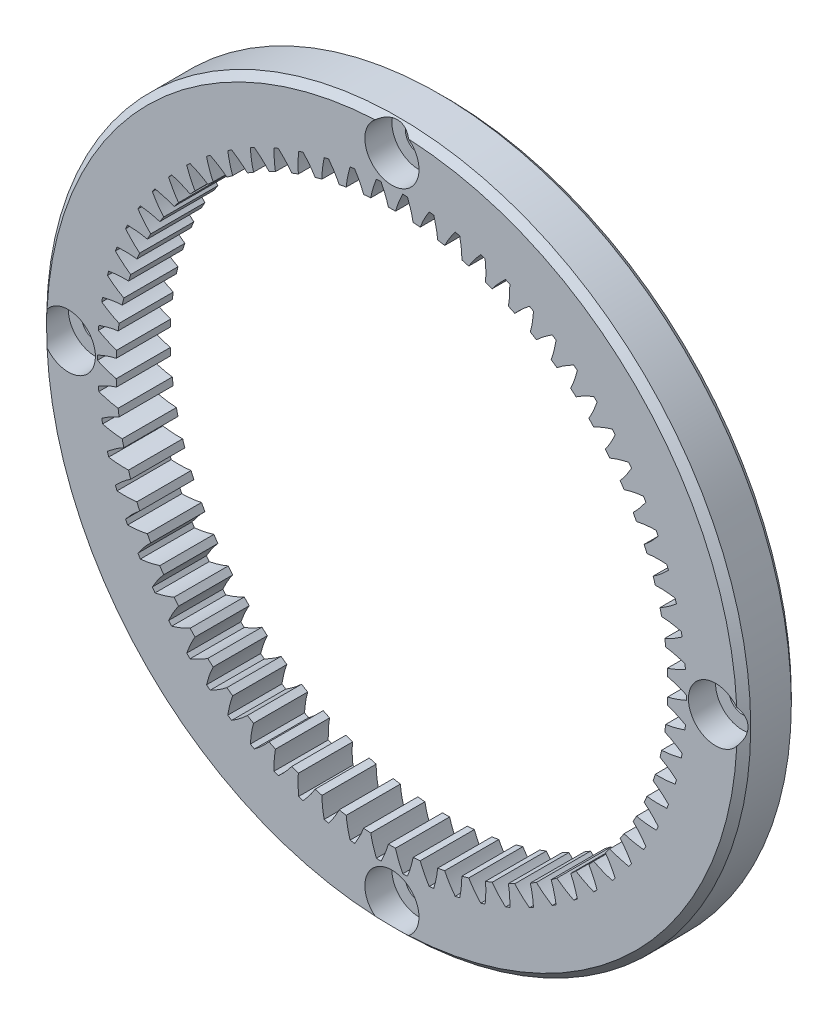
from build123d import *

# Parameters (mm, degrees)
EXTRUDE_1_OUTLINE_R      = 26
EXTRUDE_1_OUTLINE_R_2    = 21.75
EXTRUDE_1_DEPTH          = 4
EXTRUDE_2_DEPTH          = 4
PATTERN_CIRCULAR_1_COUNT = 70
CHAMFER_1_SIZE           = 0.5
SKETCH_8_R               = 1
CUT_EXTRUDE_5_DEPTH      = 37.986484029
SKETCH_9_R               = 2
CUT_EXTRUDE_7_DEPTH      = 2
PATTERN_CIRCULAR_4_COUNT = 4


# Read off the part's stored shape, not the designer's step: 凸台-拉伸1
with BuildPart() as part:
    # 凸台-拉伸1 outline → 凸台-拉伸1 (new body)
    with BuildSketch(Plane.XY):
        Circle(EXTRUDE_1_OUTLINE_R)
        Circle(EXTRUDE_1_OUTLINE_R_2, mode=Mode.SUBTRACT)
    extrude(amount=EXTRUDE_1_DEPTH)

    # 草图2 → 凸台-拉伸2 (add)
    with BuildSketch(Plane.XY):
        with BuildLine():
            ThreePointArc((0.263544056, 20.369752992), (0, 20.371457788), (-0.263544056, 20.369752992))
            add(Edge.make_bspline(
                [(-0.263544056, 20.369752992), (-0.282508899, 20.439939381), (-0.314311772, 20.548393882), (-0.362501185, 20.696698155), (-0.404742133, 20.81836785), (-0.452143037, 20.946573205), (-0.504981289, 21.081153534), (-0.56352962, 21.221939699), (-0.628056202, 21.368754227), (-0.698824227, 21.521411428), (-0.804156446, 21.737215483), (-0.889928708, 21.900091204), (-0.950433409, 22.009842264)],
                knots=[0, 0, 0, 0, 0.122377584, 0.190209739, 0.262470802, 0.339160772, 0.420279652, 0.505827439, 0.595804135, 0.690209739, 0.789044251, 1, 1, 1, 1], degree=3))
            ThreePointArc((-0.950433409, 22.009842264), (0, 22.03035361), (0.950433409, 22.009842264))
            add(Edge.make_bspline(
                [(0.263544056, 20.369752992), (0.282508899, 20.439939381), (0.314311772, 20.548393882), (0.362501185, 20.696698155), (0.404742133, 20.81836785), (0.452143037, 20.946573205), (0.504981289, 21.081153534), (0.56352962, 21.221939699), (0.628056202, 21.368754227), (0.698824227, 21.521411428), (0.804156446, 21.737215483), (0.889928708, 21.900091204), (0.950433409, 22.009842264)],
                knots=[0, 0, 0, 0, 0.122377584, 0.190209739, 0.262470802, 0.339160772, 0.420279652, 0.505827439, 0.595804135, 0.690209739, 0.789044251, 1, 1, 1, 1], degree=3))
        make_face()
    extrude_2 = extrude(amount=EXTRUDE_2_DEPTH)

    # 阵列(圆周)1: 凸台-拉伸2 ×70 about axis
    pattern_circular_1_axis = Axis((0, 0, 4), (0, 0, -1))
    for i in range(1, PATTERN_CIRCULAR_1_COUNT):
        add(extrude_2.rotate(pattern_circular_1_axis, i * 360 / PATTERN_CIRCULAR_1_COUNT))

    # 倒角1
    chamfer_1_edges = [part.edges().sort_by_distance(p)[0] for p in [
        (-26, 0, 0),
        (-26, 0, 4),
    ]]
    chamfer(chamfer_1_edges, length=CHAMFER_1_SIZE)

    # 草图8 → 切除-拉伸5 (cut, through all)
    with BuildSketch(Plane.XY.offset(4)):
        with Locations((0, 23.9)):
            Circle(SKETCH_8_R)
    cut_extrude_5 = extrude(amount=-CUT_EXTRUDE_5_DEPTH, mode=Mode.SUBTRACT)

    # 草图9 → 切除-拉伸7 (cut)
    with BuildSketch(Plane.XY.offset(4)):
        with Locations((0, 23.9)):
            Circle(SKETCH_9_R)
    cut_extrude_7 = extrude(amount=-CUT_EXTRUDE_7_DEPTH, mode=Mode.SUBTRACT)

    # 阵列(圆周)4: 切除-拉伸5, 切除-拉伸7 ×4 about axis
    pattern_circular_4_axis = Axis((0, 0, 0), (0, 0, 1))
    add([cut_extrude_5.rotate(pattern_circular_4_axis, i * 360 / PATTERN_CIRCULAR_4_COUNT) for i in range(1, PATTERN_CIRCULAR_4_COUNT)], mode=Mode.SUBTRACT)
    add([cut_extrude_7.rotate(pattern_circular_4_axis, i * 360 / PATTERN_CIRCULAR_4_COUNT) for i in range(1, PATTERN_CIRCULAR_4_COUNT)], mode=Mode.SUBTRACT)


solid = part.part
